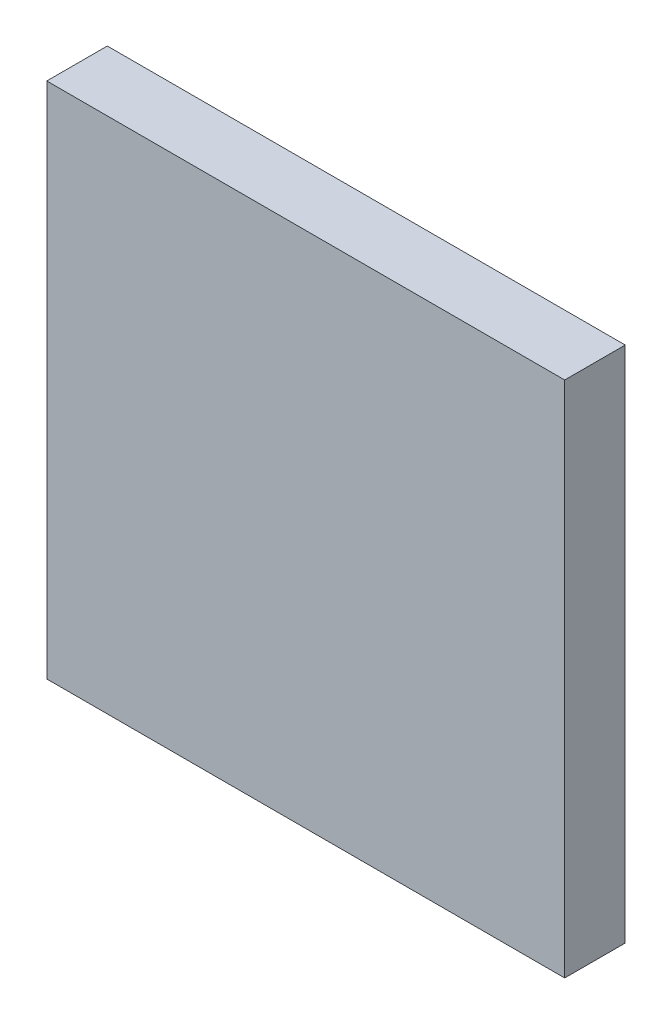
from build123d import *

# Parameters (mm, degrees)
P_IDAT_VYSUNUT_M1_DEPTH = 1.7
SKICA2_W                = 160
SKICA2_H                = 160
SKICA2_R                = 76
P_IDAT_VYSUNUT_M2_DEPTH = 15
SKICA4_W                = 160
SKICA4_H                = 160
P_IDAT_VYSUNUT_M3_DEPTH = 2


with BuildPart() as part:
    # Skica1 → Přidat vysunutím1 (new body)
    with BuildSketch(Plane.XY):
        with BuildLine():
            Line((-6.25, -75.742573893), (-6.25, -80))
            Line((-6.25, -80), (-80, -80))
            Line((-80, -80), (-80, 80))
            Line((-80, 80), (80, 80))
            Line((80, 80), (80, -80))
            Line((80, -80), (6.25, -80))
            Line((6.25, -80), (6.25, -75.742573893))
            ThreePointArc((6.25, -75.742573893), (0, 76), (-6.25, -75.742573893))
        make_face()
    extrude(amount=P_IDAT_VYSUNUT_M1_DEPTH)

    # Skica2 → Přidat vysunutím2 (add)
    with BuildSketch(Plane.XY.offset(1.7)):
        Rectangle(SKICA2_W, SKICA2_H)
        Circle(SKICA2_R, mode=Mode.SUBTRACT)
    extrude(amount=P_IDAT_VYSUNUT_M2_DEPTH)

    # Skica4 → Přidat vysunutím3 (add)
    with BuildSketch(Plane.XY.offset(16.7)):
        Rectangle(SKICA4_W, SKICA4_H)
    extrude(amount=P_IDAT_VYSUNUT_M3_DEPTH)


solid = part.part
